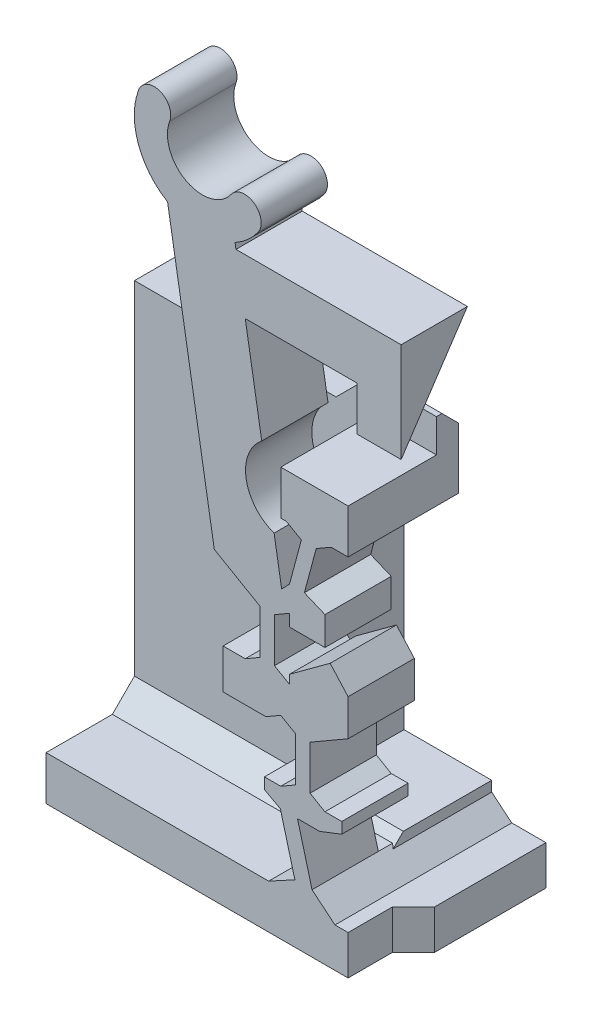
from build123d import *

# Parameters (mm, degrees)
BOSS_SWITCH_BODY_DEPTH                    = 3
SKETCH1_W                                 = 4
SKETCH1_H                                 = 3.5
BOSS_FLANGE_WIDTH_DEPTH                   = 5
BOSS_FLANGE_HEIGHT_REACH                  = 35.863
SKETCH2_W                                 = 4
SKETCH2_H                                 = 2
SKETCH2_W_2                               = 8
CUT_UP_TO_DOWN_DERAILLEUR_CLEARANCE_REACH = 21.462
SKETCH10_W                                = 2.453096586
SKETCH10_H                                = 3
SKETCH17_W                                = 12.1675
SKETCH17_H                                = 4
BOSS_FLANGE_SUPPORT_DEPTH                 = 14.499999955
TAP_DRILL_FOR_M2X0_4_TAP1_D               = 1.6
M2_CLEARANCE_HOLE2_D                      = 2.4
M2_CLEARANCE_HOLE2_DEPTH                  = 15
M2_CLEARANCE_HOLE2_TIP                    = 0.721032743
CHAMFER_FLANGE_SUPPORT_SIZE               = 1.5
CHAMFER_FLANGE_SUPPORT_2_SIZE             = 1.5
CHAMFER_FLANGE_SUPPORT_3_SIZE             = 1
SKETCH23_W                                = 3.9675
SKETCH23_H                                = 11.999999954
CUT_GAP_FOR_PRINTING_DEPTH                = 32.000499688
SKETCH25_W                                = 0.953096586
SKETCH25_H                                = 3.5
CUT_DERAILLEUR_CLEARANCE_DEPTH            = 32.145320369
CHAMFER8_SIZE                             = 1
CUT_UP_TO_DOWN_CANTILEVER_SLOPE_REACH     = 31.869
SKETCH26_W                                = 12.477246204
SKETCH26_H                                = 5.771077126
CUT_WIDE_DERAILLEUR_CLEARANCE_DEPTH       = 33.195879702
CUT_WIDE_DERAILLEUR_CLEARANCE_DEPTH_BACK  = 4
SKETCH27_W                                = 2.5
SKETCH27_H                                = 5.000000046
CHAMFER9_SIZE                             = 1.25
SKETCH28_W                                = 3.046903414
SKETCH28_H                                = 1.5
CUT_EXTRUDE1_DEPTH                        = 1


# Some blends are built 0.0001 mm under size
with BuildPart() as part:
    # Sketch-SwitchBossUp → Boss-Switch Body (new body)
    with BuildSketch(Plane.XY):
        with BuildLine():
            Line((5.581091201, 12.55524379), (5.581100766, 11.263016279))
            Line((5.581100766, 11.263016279), (3.971265023, 11.263016279))
            Line((3.971265023, 11.263016279), (3.97126394, 11.79911022))
            Line((3.97126394, 11.79911022), (3.296271341, 11.409403061))
            Line((3.296271341, 11.409403061), (3.296271341, 9.409403061))
            Line((3.296271341, 9.409403061), (3.971278743, 9.019687356))
            Line((3.971278743, 9.019687356), (3.971278743, 9.409408058))
            Line((3.971278743, 9.409408058), (5.815189336, 10.763016279))
            Line((5.815189336, 10.763016279), (6.627976927, 9.860324207))
            Line((6.627976927, 9.860324207), (6.627976927, 8.210536506))
            Line((6.627976927, 8.210536506), (5.581127833, 7.606137899))
            Line((5.581127833, 7.606137899), (4.906138119, 7.216432406))
            Line((4.906138119, 7.216432406), (4.906138119, 5.216432406))
            Line((4.906138119, 5.216432406), (5.58114552, 4.826716701))
            Line((5.58114552, 4.826716701), (6.342350466, 4.826716701))
            Line((6.342350466, 4.826716701), (6.342350466, 4.326716701))
            Line((6.342350466, 4.326716701), (5.338261222, 3.937018274))
            Line((5.338261222, 3.937018274), (4.338261222, 3.937018274))
            Line((4.338261222, 3.937018274), (4.996687221, 1.479738993))
            Line((4.996687221, 1.479738993), (6.034464198, 0.616519013))
            Line((6.034464198, 0.616519013), (6.627976927, 0.616519013))
            Line((6.627976927, 0.616519013), (6.627976927, -1.165310653))
            Line((6.627976927, -1.165310653), (3.034464198, -1.165310653))
            Line((3.034464198, -1.165310653), (3.034464198, 0.834689347))
            Line((3.034464198, 0.834689347), (4.220230086, 1.479738993))
            Line((4.220230086, 1.479738993), (3.561804087, 3.937018274))
            Line((3.561804087, 3.937018274), (2.842350466, 4.326720436))
            Line((2.842350466, 4.326720436), (2.842350466, 4.826720436))
            Line((2.842350466, 4.826720436), (3.58114552, 4.826720436))
            Line((3.58114552, 4.826720436), (4.256138119, 5.216427595))
            Line((4.256138119, 5.216427595), (4.256138119, 7.216427595))
            Line((4.256138119, 7.216427595), (3.581130717, 7.6061433))
            Line((3.581130717, 7.6061433), (2.9061262, 7.216422599))
            Line((2.9061262, 7.216422599), (0.971281627, 7.216422599))
            Line((0.971281627, 7.216422599), (0.971281627, 9.019692757))
            Line((0.971281627, 9.019692757), (1.971281627, 9.019692757))
            Line((1.971281627, 9.019692757), (2.646271341, 9.40939825))
            Line((2.646271341, 9.40939825), (2.646271341, 11.40939825))
            Line((2.646271341, 11.40939825), (1.696557212, 11.957715958))
            Line((1.696557212, 11.957715958), (0.573317845, 12.60621851))
            Line((0.573317845, 12.60621851), (-1.541303694, 25.167805745))
            ThreePointArc((-1.541303694, 25.167805745), (-2.872284003, 26.795385437), (-2.852546321, 28.897797067))
            ThreePointArc((-2.852546321, 28.897797067), (-1.887813913, 29.338582026), (-1.447028953, 28.373849618))
            ThreePointArc((-1.447028953, 28.373849618), (-0.703448682, 26.416936722), (1.333779254, 26.898727173))
            ThreePointArc((1.333779254, 26.898727173), (2.379722745, 27.074801628), (2.555797201, 26.028858137))
            ThreePointArc((2.555797201, 26.028858137), (2.086504637, 25.507104397), (1.511513111, 25.104801997))
            Line((1.511513111, 25.104801997), (1.553598189, 24.854801997))
            Line((1.553598189, 24.854801997), (9.027976927, 24.854801997))
            Line((9.027976927, 24.854801997), (9.027976927, 22.354801997))
            Line((9.027976927, 22.354801997), (9.027976927, 20.354801997))
            Line((9.027976927, 20.354801997), (7.027976927, 20.354801997))
            Line((7.027976927, 20.354801997), (7.027976927, 22.354801997))
            Line((7.027976927, 22.354801997), (1.974448974, 22.354801997))
            Line((1.974448974, 22.354801997), (2.719778232, 17.927287042))
            ThreePointArc((2.719778232, 17.927287042), (2.013826204, 16.096957693), (3.280124137, 14.598637521))
            Line((3.280124137, 14.598637521), (3.620297651, 12.577888564))
            Line((3.620297651, 12.577888564), (3.976674365, 12.944956135))
            Line((3.976674365, 12.944956135), (4.512557947, 14.944960101))
            Line((4.512557947, 14.944960101), (3.837515632, 15.334689301))
            Line((3.837515632, 15.334689301), (3.581073513, 15.334689301))
            Line((3.581073513, 15.334689301), (3.581073513, 17.334689301))
            Line((3.581073513, 17.334689301), (5.725580434, 17.334689301))
            Line((5.725580434, 17.334689301), (6.627976927, 17.334689301))
            Line((6.627976927, 17.334689301), (6.627976927, 15.334689301))
            Line((6.627976927, 15.334689301), (5.860498075, 15.334689301))
            Line((5.860498075, 15.334689301), (5.185487464, 14.944965082))
            Line((5.185487464, 14.944965082), (4.649603883, 12.944961115))
            Line((4.649603883, 12.944961115), (5.581091201, 12.55524379))
        make_face()
    extrude(amount=BOSS_SWITCH_BODY_DEPTH)

    # Sketch1 → Boss-Flange Width (add)
    with BuildSketch(Plane(origin=(0, 0, 0), x_dir=(-1, 0, 0), z_dir=(0, 0, -1))):
        Polygon((-7.581073513, -1.165310653), (0.412170615, -1.165310653), (0.412170615, 0.834689347), (-3.034464198, 0.834689347), (-4.220230086, 1.479738993), (-4.996687221, 1.479738993), (-6.034464198, 0.616519013), (-7.581073513, 0.616519013), align=None)
        with Locations((-5.581073513, 17.084689301)):
            Rectangle(SKETCH1_W, SKETCH1_H)
    extrude(amount=BOSS_FLANGE_WIDTH_DEPTH)

    # Sketch2 → Boss-Flange Height (add, up to next)
    with BuildSketch(Plane(origin=(-7.039523073, 0, 0), x_dir=(0, 0, -1), z_dir=(1, 0, 0)), mode=Mode.PRIVATE) as boss_flange_height_sk1:
        with Locations((3, 16.334689301)):
            Rectangle(SKETCH2_W, SKETCH2_H)
    boss_flange_height_tool1 = extrude(boss_flange_height_sk1.sketch, amount=BOSS_FLANGE_HEIGHT_REACH, mode=Mode.PRIVATE) - part.part
    # Sketch2 → Boss-Flange Height (add, up to next)
    with BuildSketch(Plane(origin=(-7.039523073, 0, 0), x_dir=(0, 0, -1), z_dir=(1, 0, 0)), mode=Mode.PRIVATE) as boss_flange_height_sk2:
        with Locations((1, -0.165310653)):
            Rectangle(SKETCH2_W_2, SKETCH2_H)
    boss_flange_height_tool2 = extrude(boss_flange_height_sk2.sketch, amount=BOSS_FLANGE_HEIGHT_REACH, mode=Mode.PRIVATE) - part.part
    add(boss_flange_height_tool1.solids().sort_by_distance((-7.039523, 16.334689, -3))[0])
    add(boss_flange_height_tool2.solids().sort_by_distance((-7.039523, -0.165311, -1))[0])

    # Sketch10 → Cut-Up-To-Down Derailleur Clearance (cut, up to next)
    with BuildSketch(Plane(origin=(0, 15.334689301, 0), x_dir=(1, 0, 0), z_dir=(0, 1, 0)), mode=Mode.PRIVATE) as cut_up_to_down_derailleur_clearance_sk1:
        with Locations((6.35452522, 3.5)):
            Rectangle(SKETCH10_W, SKETCH10_H)
    cut_up_to_down_derailleur_clearance_tool1 = extrude(cut_up_to_down_derailleur_clearance_sk1.sketch, amount=CUT_UP_TO_DOWN_DERAILLEUR_CLEARANCE_REACH, mode=Mode.PRIVATE) & part.part
    add(cut_up_to_down_derailleur_clearance_tool1.solids().sort_by_distance((6.354525, 15.334689, -3.5))[0], mode=Mode.SUBTRACT)

    # Sketch17 → Boss-Flange Support (add)
    with BuildSketch(Plane.XZ.offset(-15.334689301)):
        with Locations((-0.955773073, -3)):
            Rectangle(SKETCH17_W, SKETCH17_H)
    extrude(amount=BOSS_FLANGE_SUPPORT_DEPTH)

    # Tap Drill for M2x0.4 Tap1 (through all)
    with Locations(Plane(origin=(0, -1.165310653, 0), x_dir=(-1, 0, 0), z_dir=(0, -1, 0))):
        with Locations((5.039523073, 3), (0.539523073, 3)):
            Hole(TAP_DRILL_FOR_M2X0_4_TAP1_D / 2)

    # M2 Clearance Hole2
    with Locations(Plane.XZ.offset(1.165310653)):
        with Locations((-5.039523073, -3), (-0.539523073, -3)):
            Hole(M2_CLEARANCE_HOLE2_D / 2, depth=M2_CLEARANCE_HOLE2_DEPTH)
            with Locations((0, 0, -(M2_CLEARANCE_HOLE2_DEPTH + M2_CLEARANCE_HOLE2_TIP / 2))):  # 118° drill point
                Cone(0, M2_CLEARANCE_HOLE2_D / 2, M2_CLEARANCE_HOLE2_TIP, mode=Mode.SUBTRACT)

    # Chamfer-Flange Support
    chamfer_flange_support_edges = [part.edges().sort_by_distance(p)[0] for p in [
        (3.581073513, 17.334689301, -3),
    ]]
    chamfer(chamfer_flange_support_edges, length=CHAMFER_FLANGE_SUPPORT_SIZE - 0.0001)  # a hair under: the kernel refuses the full size

    # Chamfer-Flange Support 2
    chamfer_flange_support_2_edges = [part.edges().sort_by_distance(p)[0] for p in [
        (5.127976927, 17.084689301, -2),
        (5.127976927, 15.334689301, -1.5),
    ]]
    chamfer(chamfer_flange_support_2_edges, length=CHAMFER_FLANGE_SUPPORT_2_SIZE)

    # Chamfer-Flange Support 3
    chamfer_flange_support_3_edges = [part.edges().sort_by_distance(p)[0] for p in [
        (-2.002529437, 0.834689346, -1),
    ]]
    chamfer(chamfer_flange_support_3_edges, length=CHAMFER_FLANGE_SUPPORT_3_SIZE)

    # Sketch23 → Cut-Gap for Printing (cut, through all)
    with BuildSketch(Plane.XY.offset(-1)):
        with Locations((3.144226927, 7.834689324)):
            Rectangle(SKETCH23_W, SKETCH23_H)
    extrude(amount=-CUT_GAP_FOR_PRINTING_DEPTH, mode=Mode.SUBTRACT)

    # Sketch25 → Cut-Derailleur Clearance (cut, through all)
    with BuildSketch(Plane.XY):
        with Locations((7.10452522, 17.084689301)):
            Rectangle(SKETCH25_W, SKETCH25_H)
    extrude(amount=-CUT_DERAILLEUR_CLEARANCE_DEPTH, mode=Mode.SUBTRACT)

    # Chamfer8
    # the kernel refuses this chamfer: 1 mm, written as the material it adds along each edge
    with BuildSketch(Plane(origin=(6.627976927, 0.616519013, 0), x_dir=(0.9996219169112968, -2.9896548410572577e-15, -0.027495876610586365), z_dir=(0, -1, 0))) as chamfer8_piece_1_section:
        Polygon((CHAMFER8_SIZE * 0.999621916911, CHAMFER8_SIZE * 0.0274958766106), (-CHAMFER8_SIZE * 0.0274958766106, CHAMFER8_SIZE * 0.999621916911), (0, 0), align=None)
    chamfer8_piece_1 = extrude(amount=1.781829666, mode=Mode.PRIVATE)
    chamfer8_piece_1 = split(chamfer8_piece_1, bisect_by=Plane(origin=(7.581073513, -0.27439582, 0.332375145), z_dir=(-1, 0, 0)), keep=Keep.TOP, mode=Mode.PRIVATE)
    add(chamfer8_piece_1)

    # Sketch26 → Cut-Up-to-Down Cantilever Slope (cut, up to next)
    with BuildSketch(Plane(origin=(-3.086642121, 5.589000146, 8.383500218), x_dir=(-0.9561404375276108, -0.1624764728289173, -0.24371470924337582), z_dir=(0.2929086269205964, -0.5303712883154423, -0.795556932473163)), mode=Mode.PRIVATE) as cut_up_to_down_cantilever_slope_sk1:
        with Locations((-13.791615152, 17.794906754)):
            Rectangle(SKETCH26_W, SKETCH26_H)
    cut_up_to_down_cantilever_slope_tool1 = extrude(cut_up_to_down_cantilever_slope_sk1.sketch, amount=CUT_UP_TO_DOWN_CANTILEVER_SLOPE_REACH, mode=Mode.PRIVATE) & part.part
    add(cut_up_to_down_cantilever_slope_tool1.solids().sort_by_distance((10.100079, 22.636071, 1.873881))[0], mode=Mode.SUBTRACT)

    # Sketch27 → Cut-Wide Derailleur Clearance (cut, two sides: drawn at the far end of the back side and taken through both)
    with BuildSketch(Plane(origin=(5.127976927, 0, 0), x_dir=(0, 0, -1), z_dir=(1, 0, 0)).offset(-CUT_WIDE_DERAILLEUR_CLEARANCE_DEPTH_BACK)):
        with Locations((3.75, 16.334689324)):
            Rectangle(SKETCH27_W, SKETCH27_H)
    extrude(amount=CUT_WIDE_DERAILLEUR_CLEARANCE_DEPTH + CUT_WIDE_DERAILLEUR_CLEARANCE_DEPTH_BACK, mode=Mode.SUBTRACT)

    # Chamfer9
    chamfer9_edges = [part.edges().sort_by_distance(p)[0] for p in [
        (4.85452522, 18.834689347, -2.5),
    ]]
    chamfer(chamfer9_edges, length=CHAMFER9_SIZE)

    # Sketch28 → Cut-Extrude1 (cut)
    with BuildSketch(Plane.XY.offset(-1)):
        with Locations((5.10452522, 18.084689301)):
            Rectangle(SKETCH28_W, SKETCH28_H)
    extrude(amount=CUT_EXTRUDE1_DEPTH, mode=Mode.SUBTRACT)


solid = part.part
